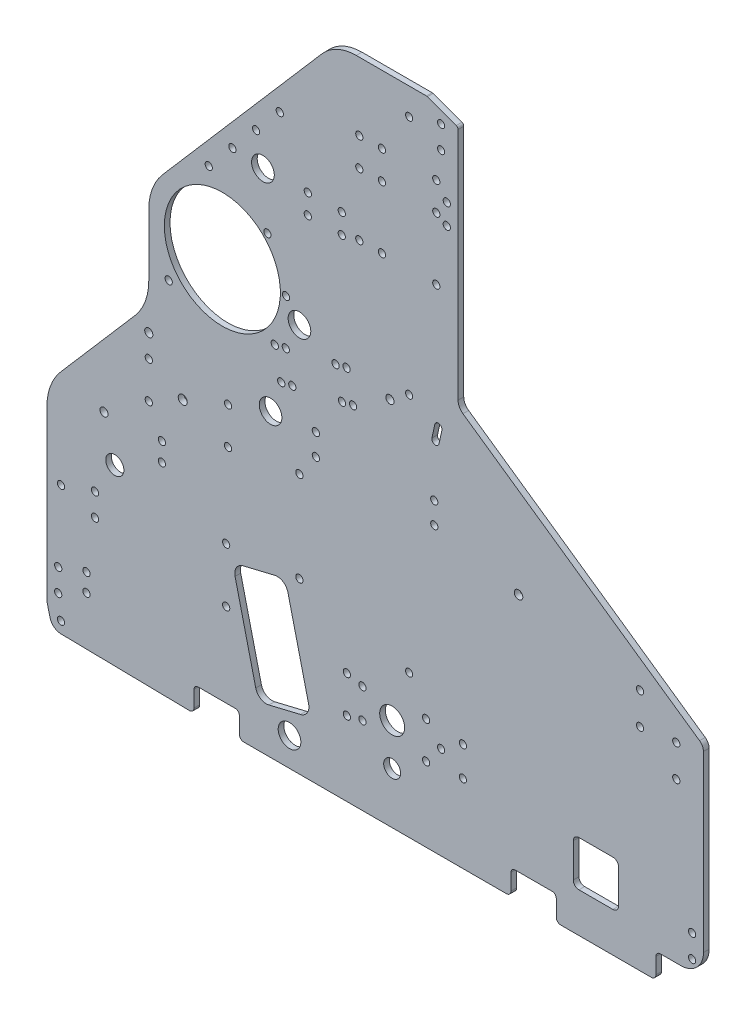
from build123d import *

# Parameters (mm, degrees)
SKETCH1_R           = 2.032
SKETCH1_R_2         = 5.08
SKETCH1_R_3         = 2.54
SKETCH1_R_4         = 6.35
SKETCH1_R_5         = 2
BOSS_EXTRUDE1_DEPTH = 3.175
FILLET1_R           = 2.286
FILLET2_R           = 6.35
SKETCH2_R           = 2.032
CUT_EXTRUDE1_DEPTH  = 505.524983177
FILLET3_R           = 1.5875
SKETCH3_R           = 6.35
SKETCH3_R_2         = 2.032
SKETCH3_R_3         = 2.286
CUT_EXTRUDE2_DEPTH  = 505.524983177
SKETCH4_R           = 2.032
SKETCH4_R_2         = 6.985
SKETCH4_R_3         = 4.7625
CUT_EXTRUDE3_DEPTH  = 505.524983177
SKETCH5_W           = 29.448186139
SKETCH5_H           = 14.946422423
SKETCH5_R           = 32.54375
SKETCH5_R_2         = 6.35
SKETCH5_R_3         = 2.39
CUT_EXTRUDE5_DEPTH  = 505.524983177
FILLET4_R           = 31.75
CUT_EXTRUDE6_DEPTH  = 505.524983177
FILLET5_R           = 25.4
SKETCH8_R           = 2.032000002
SKETCH8_R_2         = 2.031999999
SKETCH8_R_3         = 2.031999998
CUT_EXTRUDE7_DEPTH  = 505.524983177
SKETCH10_R          = 2.031999996
CUT_EXTRUDE8_DEPTH  = 505.524983177
SKETCH11_RX         = 2.032
SKETCH11_RY         = 2.031999502
CUT_EXTRUDE9_DEPTH  = 505.524983177
SKETCH12_R          = 2.032
CUT_EXTRUDE10_DEPTH = 505.524983319
SKETCH14_R          = 6.375981846
CUT_EXTRUDE11_DEPTH = 505.524983319
SKETCH15_R          = 2.286
CUT_EXTRUDE12_DEPTH = 505.524983319
FILLET6_R           = 12.7
FILLET7_R           = 5.08
FILLET8_R           = 2.54
CUT_EXTRUDE13_DEPTH = 505.524983319


with BuildPart() as part:
    # Sketch1 → Boss-Extrude1 (new body)
    with BuildSketch(Plane.XY):
        with BuildLine():
            Line((7.829508682, -19.049081656), (82.55, -20.32))
            Line((82.55, -20.32), (82.55, -6.35))
            Line((82.55, -6.35), (107.95, -6.35))
            Line((107.95, -6.35), (107.95, -20.32))
            Line((107.95, -20.32), (260.35, -20.32))
            Line((260.35, -20.32), (260.35, -6.35))
            Line((260.35, -6.35), (285.75, -6.35))
            Line((285.75, -6.35), (285.75, -20.32))
            Line((285.75, -20.32), (368.3, -20.32))
            Line((368.3, -20.32), (368.3, 106.68))
            Line((368.3, 106.68), (230.66375, 202.565))
            Line((230.66375, 202.565), (230.66375, 338.455))
            Line((230.66375, 338.455), (213.19998, 344.805))
            Line((213.19998, 344.805), (203.2, 344.805))
            Line((203.2, 344.805), (161.925, 344.805))
            Line((161.925, 344.805), (52.720122664, 218.469945827))
            ThreePointArc((52.720122664, 218.469945827), (52.803835479, 218.142145922), (52.832, 217.805))
            ThreePointArc((52.832, 217.805), (52.095493096, 216.239521914), (50.419872403, 215.808871996))
            Line((50.419872403, 215.808871996), (0, 157.48))
            Line((0, 157.48), (0, 0))
            Line((0, 0), (0, -6.35))
            ThreePointArc((0, -6.35), (0.047577015, -7.125863724), (0.189595124, -7.890101219))
            Line((0.189595124, -7.890101219), (1.777095124, -14.240101219))
            ThreePointArc((1.777095124, -14.240101219), (3.987212552, -17.671692778), (7.829508682, -19.049081656))
        make_face()
        with Locations((7.9375, -12.7)):
            Circle(SKETCH1_R, mode=Mode.SUBTRACT)
        with Locations((6.35, 0)):
            Circle(SKETCH1_R, mode=Mode.SUBTRACT)
        with Locations((6.35, 12.7)):
            Circle(SKETCH1_R, mode=Mode.SUBTRACT)
        with Locations((38.1, 78.105)):
            Circle(SKETCH1_R_2, mode=Mode.SUBTRACT)
        with Locations((57.15, 118.58625)):
            Circle(SKETCH1_R, mode=Mode.SUBTRACT)
        with Locations((57.15, 139.22375)):
            Circle(SKETCH1_R, mode=Mode.SUBTRACT)
        with Locations((76.2, 128.905)):
            Circle(SKETCH1_R_3, mode=Mode.SUBTRACT)
        with Locations((101.6, 118.58625)):
            Circle(SKETCH1_R, mode=Mode.SUBTRACT)
        with Locations((101.6, 139.22375)):
            Circle(SKETCH1_R, mode=Mode.SUBTRACT)
        with Locations((125.468192568, 147.91106164)):
            Circle(SKETCH1_R_4, mode=Mode.SUBTRACT)
        with Locations((203.2, 59.805)):
            Circle(SKETCH1_R_5, mode=Mode.SUBTRACT)
        with Locations((361.95, 0)):
            Circle(SKETCH1_R, mode=Mode.SUBTRACT)
        with Locations((361.95, 12.7)):
            Circle(SKETCH1_R, mode=Mode.SUBTRACT)
        with Locations((353.06, 82.955052336)):
            Circle(SKETCH1_R, mode=Mode.SUBTRACT)
        with Locations((332.74, 98.195052336)):
            Circle(SKETCH1_R, mode=Mode.SUBTRACT)
        with Locations((332.74, 115.975052336)):
            Circle(SKETCH1_R, mode=Mode.SUBTRACT)
        with Locations((353.06, 100.735052336)):
            Circle(SKETCH1_R, mode=Mode.SUBTRACT)
        with Locations((68.326, 182.923674932)):
            Circle(SKETCH1_R, mode=Mode.SUBTRACT)
        with Locations((76.2, 217.805)):
            Circle(SKETCH1_R, mode=Mode.SUBTRACT)
        with Locations((90.779500502, 249.682)):
            Circle(SKETCH1_R, mode=Mode.SUBTRACT)
        with Locations((104.067838673, 265.054783374)):
            Circle(SKETCH1_R, mode=Mode.SUBTRACT)
        with Locations((117.356176844, 280.427566748)):
            Circle(SKETCH1_R, mode=Mode.SUBTRACT)
        with Locations((130.644515014, 295.800350122)):
            Circle(SKETCH1_R, mode=Mode.SUBTRACT)
        with Locations((203.2, 194.805)):
            Circle(SKETCH1_R_5, mode=Mode.SUBTRACT)
        with Locations((224.31375, 287.401)):
            Circle(SKETCH1_R, mode=Mode.SUBTRACT)
        with Locations((224.31375, 298.831)):
            Circle(SKETCH1_R, mode=Mode.SUBTRACT)
        with Locations((203.2, 329.805)):
            Circle(SKETCH1_R_5, mode=Mode.SUBTRACT)
        with Locations((221.138115, 322.58)):
            Circle(SKETCH1_R_5, mode=Mode.SUBTRACT)
        with Locations((221.138115, 335.28)):
            Circle(SKETCH1_R_5, mode=Mode.SUBTRACT)
    extrude(amount=BOSS_EXTRUDE1_DEPTH)

    # Fillet1
    fillet1_edges = [part.edges().sort_by_distance(p)[0] for p in [
        (285.75, -6.35, 1.5875),
        (107.95, -6.35, 1.5875),
        (260.35, -6.35, 1.5875),
        (82.55, -6.35, 1.5875),
    ]]
    fillet(fillet1_edges, radius=FILLET1_R)

    # Fillet2
    fillet2_edges = [part.edges().sort_by_distance(p)[0] for p in [
        (230.66375, 202.565, 1.5875),
    ]]
    fillet(fillet2_edges, radius=FILLET2_R)

    # Sketch2 → Cut-Extrude1 (cut, through all)
    with BuildSketch(Plane(origin=(0, 0, 0), x_dir=(-1, 0, 0), z_dir=(0, 0, -1))):
        with Locations((-100.552770272, 71.086035298)):
            Circle(SKETCH2_R)
        with Locations((-100.552770272, 40.606035298)):
            Circle(SKETCH2_R)
        with Locations((-22.225, 18.202541089)):
            Circle(SKETCH2_R)
        with Locations((-22.225, 8.042541089)):
            Circle(SKETCH2_R)
    extrude(amount=-CUT_EXTRUDE1_DEPTH, mode=Mode.SUBTRACT)

    # Fillet3
    fillet3_edges = [part.edges().sort_by_distance(p)[0] for p in [
        (230.66375, 338.455, 1.5875),
        (213.19998, 344.805, 1.5875),
    ]]
    fillet(fillet3_edges, radius=FILLET3_R)

    # Sketch3 → Cut-Extrude2 (cut, through all)
    with BuildSketch(Plane.XY.offset(3.175)):
        with BuildLine():
            Line((127.789350211, 69.359774106), (110.090750339, 65.117184968))
            ThreePointArc((110.090750339, 65.117184968), (106.287939856, 62.356288953), (105.55119507, 57.715047577))
            Line((105.55119507, 57.715047577), (117.160037875, 9.287010566))
            ThreePointArc((117.160037875, 9.287010566), (119.92093389, 5.484200083), (124.562175266, 4.747455297))
            Line((124.562175266, 4.747455297), (142.260775137, 8.990044434))
            ThreePointArc((142.260775137, 8.990044434), (146.063585621, 11.75094045), (146.800330407, 16.392181825))
            Line((146.800330407, 16.392181825), (135.191487602, 64.820218836))
            ThreePointArc((135.191487602, 64.820218836), (132.430591586, 68.62302932), (127.789350211, 69.359774106))
        make_face()
        with Locations((136.094563167, -4.324155877)):
            Circle(SKETCH3_R)
        with Locations((26.987500002, 46.953113935)):
            Circle(SKETCH3_R_2)
        with Locations((26.987500002, 59.653113935)):
            Circle(SKETCH3_R_2)
        with Locations((7.937500002, 53.303113935)):
            Circle(SKETCH3_R_2)
        with Locations((32.030600738, 100.810868776)):
            Circle(SKETCH3_R_3)
        with Locations((64.525942114, 102.94048958)):
            Circle(SKETCH3_R_2)
        with Locations((64.525942114, 92.525786339)):
            Circle(SKETCH3_R_2)
        with Locations((134.14375, 208.228121768)):
            Circle(SKETCH3_R_2)
        with Locations((123.681970341, 233.485092108)):
            Circle(SKETCH3_R_2)
    extrude(amount=-CUT_EXTRUDE2_DEPTH, mode=Mode.SUBTRACT)

    # Sketch4 → Cut-Extrude3 (cut, through all)
    with BuildSketch(Plane.XY.offset(3.175)):
        with Locations((168.275, 42.06875)):
            Circle(SKETCH4_R)
        with Locations((212.725, 42.06875)):
            Circle(SKETCH4_R)
        with Locations((212.725, 21.43125)):
            Circle(SKETCH4_R)
        with Locations((168.275, 21.43125)):
            Circle(SKETCH4_R)
        with Locations((193.675, 31.75)):
            Circle(SKETCH4_R_2)
        with Locations((177.00498, 40.0431)):
            Circle(SKETCH4_R)
        with Locations((177.00498, 23.4569)):
            Circle(SKETCH4_R)
        with Locations((193.675, 8.466666658)):
            Circle(SKETCH4_R_3)
        with Locations((221.138115, 31.75)):
            Circle(SKETCH4_R)
        with Locations((233.36123, 23.4569)):
            Circle(SKETCH4_R)
        with Locations((233.36123, 40.0431)):
            Circle(SKETCH4_R)
    extrude(amount=-CUT_EXTRUDE3_DEPTH, mode=Mode.SUBTRACT)

    # Sketch5 → Cut-Extrude5 (cut, through all)
    with BuildSketch(Plane(origin=(0, 0, 0), x_dir=(-1, 0, 0), z_dir=(0, 0, -1))):
        Polygon((0, 157.48), (-57.15, 223.594705882), (-57.15, 165.333696112), (0, 99.218990229), align=None)
        with Locations((-356.354093068, -13.823211213)):
            Rectangle(SKETCH5_W, SKETCH5_H)
        with Locations((-98.425, 208.228121768)):
            Circle(SKETCH5_R)
        with Locations((-141.675587431, 197.971943782)):
            Circle(SKETCH5_R_2)
        with Locations((-264.573581764, 128.332790468)):
            Circle(SKETCH5_R_3)
    extrude(amount=-CUT_EXTRUDE5_DEPTH, mode=Mode.SUBTRACT)

    # Fillet4
    fillet4_edges = [part.edges().sort_by_distance(p)[0] for p in [
        (0, 99.218990229, 1.5875),
        (57.15, 165.333696112, 1.5875),
        (57.15, 223.594705882, 1.5875),
    ]]
    fillet(fillet4_edges, radius=FILLET4_R)

    # Sketch6 → Cut-Extrude6 (cut, through all)
    with BuildSketch(Plane.XY.offset(3.175)):
        with BuildLine():
            Line((298.45, 27.305), (317.5, 27.305))
            ThreePointArc((317.5, 27.305), (319.74506403, 26.37506403), (320.675, 24.13))
            Line((320.675, 24.13), (320.675, 5.08))
            ThreePointArc((320.675, 5.08), (319.74506403, 2.83493597), (317.5, 1.905))
            Line((317.5, 1.905), (298.45, 1.905))
            ThreePointArc((298.45, 1.905), (296.20493597, 2.83493597), (295.275, 5.08))
            Line((295.275, 5.08), (295.275, 24.13))
            ThreePointArc((295.275, 24.13), (296.20493597, 26.37506403), (298.45, 27.305))
        make_face()
    extrude(amount=-CUT_EXTRUDE6_DEPTH, mode=Mode.SUBTRACT)

    # Fillet5
    fillet5_edges = [part.edges().sort_by_distance(p)[0] for p in [
        (161.925, 344.805, 1.5875),
    ]]
    fillet(fillet5_edges, radius=FILLET5_R)

    # Sketch8 → Cut-Extrude7 (cut, through all)
    with BuildSketch(Plane(origin=(0, 0, 0), x_dir=(-1, 0, 0), z_dir=(0, 0, -1))):
        with Locations((-218.44, 290.83)):
            Circle(SKETCH8_R)
        with Locations((-187.96, 290.83)):
            Circle(SKETCH8_R)
        with Locations((-187.96, 306.70500001)):
            Circle(SKETCH8_R_2)
        with Locations((-175.26, 290.83)):
            Circle(SKETCH8_R)
        with Locations((-187.96, 255.905)):
            Circle(SKETCH8_R)
        with Locations((-218.44, 306.70500001)):
            Circle(SKETCH8_R_3)
        with Locations((-175.26, 306.70500001)):
            Circle(SKETCH8_R_2)
        with Locations((-175.26, 255.905)):
            Circle(SKETCH8_R)
        with Locations((-218.44, 255.905)):
            Circle(SKETCH8_R)
    extrude(amount=-CUT_EXTRUDE7_DEPTH, mode=Mode.SUBTRACT)

    # Sketch10 → Cut-Extrude8 (cut, through all)
    with BuildSketch(Plane.XY.offset(3.175)):
        with Locations((141.642480004, 74.684371768)):
            Circle(SKETCH10_R)
        with Locations((141.642480004, 125.484371768)):
            Circle(SKETCH10_R)
    extrude(amount=-CUT_EXTRUDE8_DEPTH, mode=Mode.SUBTRACT)

    # Sketch11 → Cut-Extrude9 (cut, through all)
    with BuildSketch(Plane.XY.offset(3.175)):
        with Locations(Location((150.881424454, 138.43), (0, 0, 90))):
            Ellipse(SKETCH11_RX, SKETCH11_RY)
        with Locations(Location((150.881424454, 150.495), (0, 0, 90))):
            Ellipse(SKETCH11_RX, SKETCH11_RY)
        with Locations(Location((217.30240818, 150.495), (0, 0, 90))):
            Ellipse(SKETCH11_RX, SKETCH11_RY)
        with Locations(Location((217.30240818, 138.43), (0, 0, 90))):
            Ellipse(SKETCH11_RX, SKETCH11_RY)
    extrude(amount=-CUT_EXTRUDE9_DEPTH, mode=Mode.SUBTRACT)

    # Sketch12 → Cut-Extrude10 (cut, through all)
    with BuildSketch(Plane(origin=(0, 0, 0), x_dir=(-1, 0, 0), z_dir=(0, 0, -1))):
        with Locations((-165.4175, 264.63498)):
            Circle(SKETCH12_R)
        with Locations((-165.4175, 253.52248)):
            Circle(SKETCH12_R)
        with Locations((-146.3675, 253.52248)):
            Circle(SKETCH12_R)
        with Locations((-146.3675, 264.63498)):
            Circle(SKETCH12_R)
    extrude(amount=-CUT_EXTRUDE10_DEPTH, mode=Mode.SUBTRACT)

    # Sketch14 → Cut-Extrude11 (cut, through all)
    with BuildSketch(Plane(origin=(0, 0, 0), x_dir=(-1, 0, 0), z_dir=(0, 0, -1))):
        with Locations((-121.184716432, 263.688494682)):
            Circle(SKETCH14_R)
    extrude(amount=-CUT_EXTRUDE11_DEPTH, mode=Mode.SUBTRACT)

    # Sketch15 → Cut-Extrude12 (cut, through all)
    with BuildSketch(Plane.XY.offset(3.175)):
        with Locations((57.15, 151.92375)):
            Circle(SKETCH15_R)
        with Locations((192.439038956, 187.119947783)):
            Circle(SKETCH15_R)
        with BuildLine():
            ThreePointArc((163.873739892, 173.680575348), (163.573171662, 172.102507308), (164.512499361, 170.799317578))
            ThreePointArc((164.512499361, 170.799317578), (167.540838635, 172.982117899), (163.873739892, 173.680575348))
        make_face()
        with BuildLine():
            ThreePointArc((173.43975005, 172.778441408), (173.74031828, 174.356509448), (172.800990581, 175.659699178))
            ThreePointArc((172.800990581, 175.659699178), (169.772651307, 173.476898857), (173.43975005, 172.778441408))
        make_face()
        with BuildLine():
            ThreePointArc((169.158852977, 192.088320238), (166.130513704, 189.905519916), (169.797612447, 189.207062467))
            ThreePointArc((169.797612447, 189.207062467), (170.098180676, 190.785130507), (169.158852977, 192.088320238))
        make_face()
        with BuildLine():
            ThreePointArc((160.231602288, 190.109196408), (159.931034058, 188.531128368), (160.870361758, 187.227938637))
            ThreePointArc((160.870361758, 187.227938637), (163.898701031, 189.410738959), (160.231602288, 190.109196408))
        make_face()
        with BuildLine():
            ThreePointArc((129.776601843, 166.121421831), (129.476033613, 164.543353791), (130.415361312, 163.240164061))
            ThreePointArc((130.415361312, 163.240164061), (133.443700586, 165.422964382), (129.776601843, 166.121421831))
        make_face()
        with BuildLine():
            ThreePointArc((139.342612002, 165.219287891), (139.643180231, 166.797355931), (138.703852532, 168.100545661))
            ThreePointArc((138.703852532, 168.100545661), (135.675513258, 165.91774534), (139.342612002, 165.219287891))
        make_face()
        with BuildLine():
            ThreePointArc((135.700474398, 181.647908951), (136.001042628, 183.225976991), (135.061714929, 184.529166721))
            ThreePointArc((135.061714929, 184.529166721), (132.033375655, 182.3463664), (135.700474398, 181.647908951))
        make_face()
        with BuildLine():
            ThreePointArc((126.134464239, 182.550042891), (125.83389601, 180.971974851), (126.773223709, 179.668785121))
            ThreePointArc((126.773223709, 179.668785121), (129.801562983, 181.851585442), (126.134464239, 182.550042891))
        make_face()
    extrude(amount=-CUT_EXTRUDE12_DEPTH, mode=Mode.SUBTRACT)

    # Fillet6
    fillet6_edges = [part.edges().sort_by_distance(p)[0] for p in [
        (368.3, -6.350000001, 1.5875),
    ]]
    fillet(fillet6_edges, radius=FILLET6_R)

    # Fillet7
    fillet7_edges = [part.edges().sort_by_distance(p)[0] for p in [
        (368.3, 106.68, 1.5875),
    ]]
    fillet(fillet7_edges, radius=FILLET7_R)

    # Fillet8
    fillet8_edges = [part.edges().sort_by_distance(p)[0] for p in [
        (82.55, -20.32, 1.5875),
        (107.95, -20.32, 1.5875),
        (260.35, -20.32, 1.5875),
        (285.75, -20.32, 1.5875),
        (341.629999999, -20.32, 1.5875),
        (341.629999999, -6.350000001, 1.5875),
    ]]
    fillet(fillet8_edges, radius=FILLET8_R)

    # Sketch17 → Cut-Extrude13 (cut, through all)
    with BuildSketch(Plane.XY.offset(3.175)):
        with BuildLine():
            Line((215.978923734, 180.140302992), (217.611309954, 187.583401488))
            ThreePointArc((217.611309954, 187.583401488), (220.031439212, 189.132924762), (221.580962485, 186.712795505))
            Line((221.580962485, 186.712795505), (219.948576266, 179.269697008))
            ThreePointArc((219.948576266, 179.269697008), (217.528447008, 177.720173734), (215.978923734, 180.140302992))
        make_face()
    extrude(amount=-CUT_EXTRUDE13_DEPTH, mode=Mode.SUBTRACT)


solid = part.part
